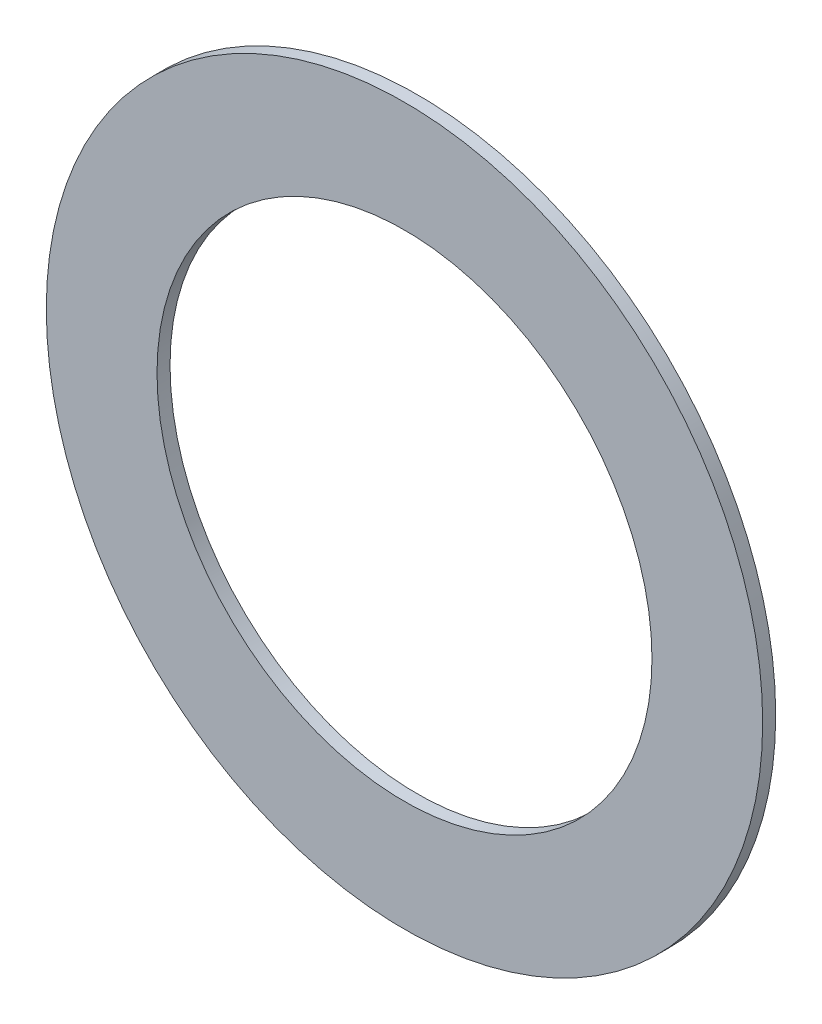
from build123d import *

# Parameters (mm, degrees)
SKIZZE1_R                       = 27.5
SKIZZE1_R_2                     = 19
AUFSATZ_LINEAR_AUSTRAGEN1_DEPTH = 0.5


with BuildPart() as part:
    # Skizze1 → Aufsatz-Linear austragen1 (new, symmetric)
    with BuildSketch(Plane.XY):
        Circle(SKIZZE1_R)
        Circle(SKIZZE1_R_2, mode=Mode.SUBTRACT)
    extrude(amount=AUFSATZ_LINEAR_AUSTRAGEN1_DEPTH, both=True)


solid = part.part
